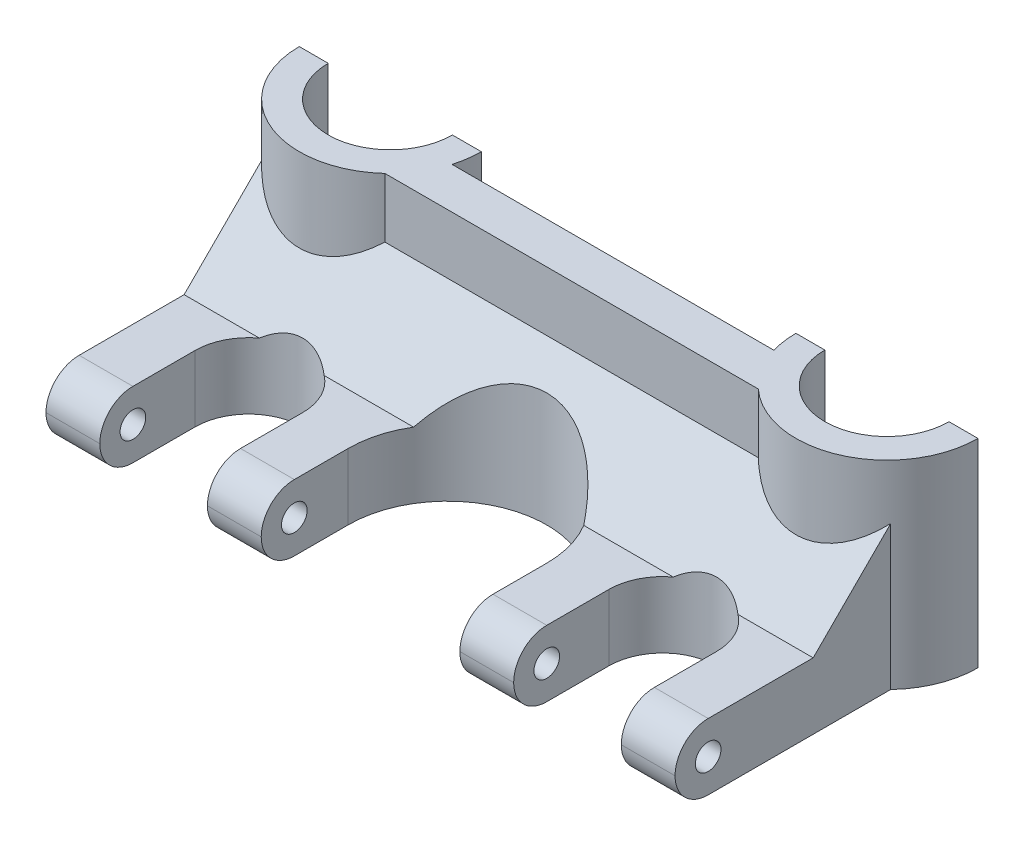
from build123d import *

# Parameters (mm, degrees)
SKETCH1_W                       = 50
SKETCH1_H                       = 5
BOSS_EXTRUDE1_DEPTH             = 24
SKETCH5_W                       = 76
SKETCH5_H                       = 20
BOSS_EXTRUDE3_DEPTH             = 8
BOSS_EXTRUDE4_REACH             = 54.953
BOSS_EXTRUDE4_DIRECTION_2_REACH = 54.953
CUT_EXTRUDE4_DEPTH              = 50.839743178
FILLET1_R                       = 4
SKETCH8_R                       = 1.55
CUT_EXTRUDE5_DEPTH              = 85.474848328
BOSS_EXTRUDE2_REACH             = 54.953
SKETCH4_R                       = 7.5
CUT_EXTRUDE3_DEPTH              = 56.145262716


with BuildPart() as part:
    # Sketch1 → Boss-Extrude1 (new body)
    with BuildSketch(Plane(origin=(0, 0, 0), x_dir=(1, 0, 0), z_dir=(0, 1, 0))):
        Rectangle(SKETCH1_W, SKETCH1_H)
    extrude(amount=BOSS_EXTRUDE1_DEPTH)


with BuildPart() as body_2:
    # Sketch5 → Boss-Extrude3 (new body)
    with BuildSketch(Plane(origin=(0, 0, 0), x_dir=(1, 0, 0), z_dir=(0, 1, 0))):
        with Locations((0, -18)):
            Rectangle(SKETCH5_W, SKETCH5_H)
    extrude(amount=BOSS_EXTRUDE3_DEPTH)

    # Boss-Extrude4: up to this face of the body (flat: up to its plane)
    boss_extrude4_end = Plane(body_2.part.faces().sort_by_distance((38, 4, 18))[0])
    # Sketch6 → Boss-Extrude4 (add, up to the picked face)
    with BuildSketch(Plane(origin=(0, 0, 0), x_dir=(0, 0, -1), z_dir=(1, 0, 0)), mode=Mode.PRIVATE) as boss_extrude4_sk1:
        Polygon((-11.313708499, 8), (0, 19.313708499), (2.5, 19.313708499), (2.5, 0), (-11.313708499, 0), align=None)
    boss_extrude4_tool1 = split(extrude(boss_extrude4_sk1.sketch, amount=BOSS_EXTRUDE4_REACH, mode=Mode.PRIVATE), bisect_by=boss_extrude4_end, keep=Keep.BOTH, mode=Mode.PRIVATE)

    add(part.part)  # Boss-Extrude4 merges part
    add(boss_extrude4_tool1.solids().sort_by(Axis((0, 7.799404, 3.417281), (1, 0, 0)))[0])

    # Boss-Extrude4 direction 2: up to this face of the body (flat: up to its plane)
    boss_extrude4_direction_2_end = Plane(body_2.part.faces().sort_by_distance((-38, 4, 18))[0])
    # Sketch6 → Boss-Extrude4 direction 2 (add, up to the picked face)
    with BuildSketch(Plane(origin=(0, 0, 0), x_dir=(0, 0, -1), z_dir=(1, 0, 0)), mode=Mode.PRIVATE) as boss_extrude4_direction_2_sk1:
        Polygon((-11.313708499, 8), (0, 19.313708499), (2.5, 19.313708499), (2.5, 0), (-11.313708499, 0), align=None)
    boss_extrude4_direction_2_tool1 = split(extrude(boss_extrude4_direction_2_sk1.sketch, amount=-BOSS_EXTRUDE4_DIRECTION_2_REACH, mode=Mode.PRIVATE), bisect_by=boss_extrude4_direction_2_end, keep=Keep.BOTH, mode=Mode.PRIVATE)
    add(boss_extrude4_direction_2_tool1.solids().sort_by(Axis((0, 7.799404, 3.417281), (-1, 0, 0)))[0])

    # Sketch7 → Cut-Extrude4 (cut, symmetric)
    with BuildSketch(Plane(origin=(0, 8, 0), x_dir=(1, 0, 0), z_dir=(0, 1, 0))):
        with BuildLine():
            Line((-12, -17.5), (-12, -28))
            Line((-12, -28), (12, -28))
            Line((12, -28), (12, -17.5))
            ThreePointArc((12, -17.5), (0, -5.5), (-12, -17.5))
        make_face()
        with BuildLine():
            Line((-31.5, -16.5), (-31.5, -28))
            Line((-31.5, -28), (-18.5, -28))
            Line((-18.5, -28), (-18.5, -16.5))
            ThreePointArc((-18.5, -16.5), (-25, -10), (-31.5, -16.5))
        make_face()
    cut_extrude4 = extrude(amount=CUT_EXTRUDE4_DEPTH, both=True, mode=Mode.SUBTRACT)

    # Mirror2: Cut-Extrude4 across plane
    add(cut_extrude4.mirror(Plane(origin=(0, 0, 0), x_dir=(0, 0, 1), z_dir=(1, 0, 0))), mode=Mode.SUBTRACT)

    # Fillet1
    fillet1_edges = [body_2.edges().sort_by_distance(p)[0] for p in [
        (-34.75, 0, 28),
        (-34.75, 8, 28),
        (34.75, 0, 28),
        (34.75, 8, 28),
        (15.25, 8, 28),
        (15.25, 0, 28),
        (-15.25, 0, 28),
        (-15.25, 8, 28),
    ]]
    fillet(fillet1_edges, radius=FILLET1_R - 0.0001)  # a hair under: the kernel refuses the full size

    # Sketch8 → Cut-Extrude5 (cut, through all)
    with BuildSketch(Plane(origin=(38, 0, 0), x_dir=(0, 0, -1), z_dir=(1, 0, 0))):
        with Locations((-24, 4)):
            Circle(SKETCH8_R)
    extrude(amount=-CUT_EXTRUDE5_DEPTH, mode=Mode.SUBTRACT)

    # Boss-Extrude2: up to this face of the body (flat: up to its plane)
    boss_extrude2_end = Plane(body_2.part.faces().sort_by_distance((0, 24, 0))[0])
    # Sketch2 → Boss-Extrude2 (add, up to the picked face)
    with BuildSketch(Plane(origin=(0, 0, 0), x_dir=(1, 0, 0), z_dir=(0, 1, 0)), mode=Mode.PRIVATE) as boss_extrude2_sk1:
        with BuildLine():
            Line((19, 5.6), (41, 5.6))
            ThreePointArc((41, 5.6), (30, -5.4), (19, 5.6))
        make_face()
    boss_extrude2_tool1 = split(extrude(boss_extrude2_sk1.sketch, amount=BOSS_EXTRUDE2_REACH, mode=Mode.PRIVATE), bisect_by=boss_extrude2_end, keep=Keep.BOTH, mode=Mode.PRIVATE)
    boss_extrude2 = boss_extrude2_tool1.solids().sort_by(Axis((30, 0, -0.931455), (0, 1, 0)))[0]
    add(boss_extrude2)

    # Sketch4 → Cut-Extrude3 (cut, through all)
    with BuildSketch(Plane(origin=(0, 0, 0), x_dir=(1, 0, 0), z_dir=(0, 1, 0))):
        with Locations((30, 5.6)):
            Circle(SKETCH4_R)
    cut_extrude3 = extrude(amount=CUT_EXTRUDE3_DEPTH, mode=Mode.SUBTRACT)

    # Mirror1: Boss-Extrude2, Cut-Extrude3 across plane
    add(boss_extrude2.mirror(Plane(origin=(0, 0, 0), x_dir=(0, 0, 1), z_dir=(1, 0, 0))))
    add(cut_extrude3.mirror(Plane(origin=(0, 0, 0), x_dir=(0, 0, 1), z_dir=(1, 0, 0))), mode=Mode.SUBTRACT)


solid = body_2.part
